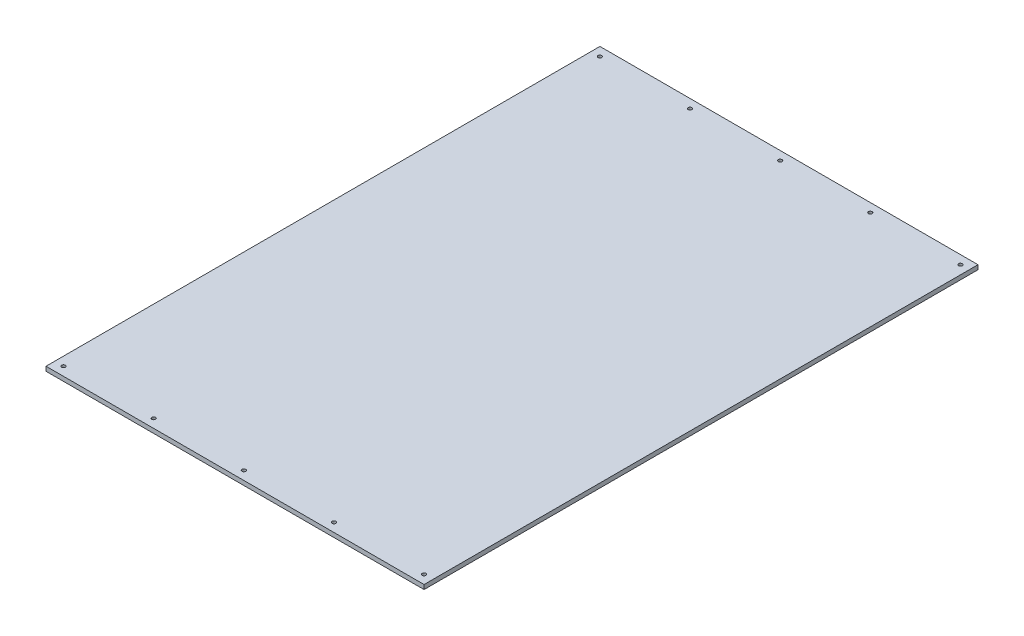
from build123d import *

# Parameters (mm, degrees)
SKETCH1_W           = 430
SKETCH1_H           = 630
BOSS_EXTRUDE1_DEPTH = 5
SKETCH2_R           = 2.1
CUT_EXTRUDE1_DEPTH  = 5


with BuildPart() as part:
    # Sketch1 → Boss-Extrude1 (new body)
    with BuildSketch(Plane(origin=(0, 0, 0), x_dir=(1, 0, 0), z_dir=(0, 1, 0))):
        Rectangle(SKETCH1_W, SKETCH1_H)
    extrude(amount=BOSS_EXTRUDE1_DEPTH)

    # Sketch2 → Cut-Extrude1 (cut)
    with BuildSketch(Plane(origin=(0, 5, 0), x_dir=(1, 0, 0), z_dir=(0, 1, 0))):
        with Locations((0, 305)):
            Circle(SKETCH2_R)
        with Locations((102.5, 305)):
            Circle(SKETCH2_R)
        with Locations((205, 305)):
            Circle(SKETCH2_R)
        with Locations((-102.5, 305)):
            Circle(SKETCH2_R)
        with Locations((-205, 305)):
            Circle(SKETCH2_R)
        with Locations((205, -305)):
            Circle(SKETCH2_R)
        with Locations((102.5, -305)):
            Circle(SKETCH2_R)
        with Locations((0, -305)):
            Circle(SKETCH2_R)
        with Locations((-102.5, -305)):
            Circle(SKETCH2_R)
        with Locations((-205, -305)):
            Circle(SKETCH2_R)
    extrude(amount=-CUT_EXTRUDE1_DEPTH, mode=Mode.SUBTRACT)


solid = part.part
